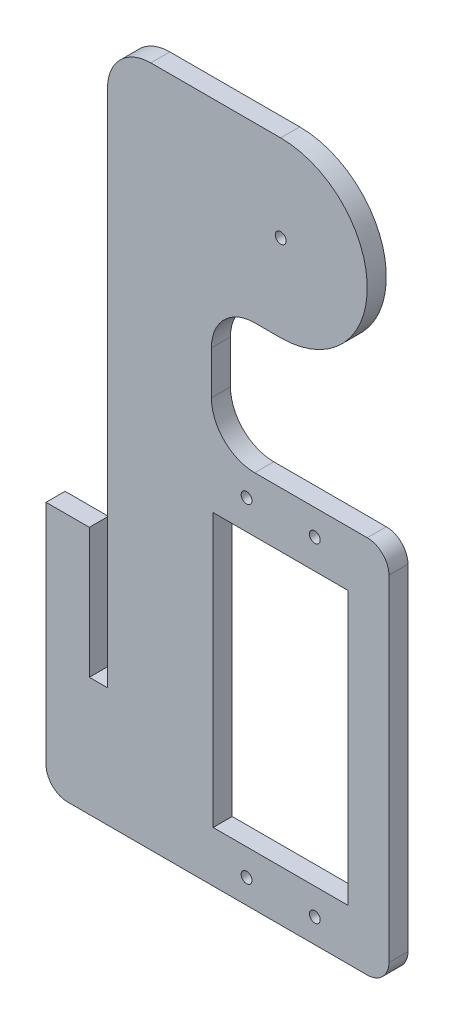
from build123d import *

# Parameters (mm, degrees)
SKETCH1_R           = 0.79375
SKETCH1_W           = 19.812
SKETCH1_H           = 40
BOSS_EXTRUDE1_DEPTH = 2.794
FILLET1_R           = 6.35
FILLET2_R           = 6.35
FILLET3_R           = 3.175


with BuildPart() as part:
    # Sketch1 → Boss-Extrude1 (new body)
    with BuildSketch(Plane.XY):
        with BuildLine():
            Line((6.440932537, 4.734159763), (50.8, 4.734159763))
            Line((50.8, 4.734159763), (50.8, 36.343152622))
            Line((50.8, 36.343152622), (50.8, 60.284785263))
            Line((50.8, 60.284785263), (24.765, 60.284785263))
            Line((24.765, 60.284785263), (24.765, 79.327185263))
            Line((24.765, 79.327185263), (34.925, 79.327185263))
            ThreePointArc((34.925, 79.327185263), (47.625, 92.027185263), (34.925, 104.727185263))
            Line((34.925, 104.727185263), (9.525, 104.727185263))
            Line((9.525, 104.727185263), (9.525, 38.1))
            Line((9.525, 38.1), (9.525, 22.177185263))
            Line((9.525, 22.177185263), (6.858, 22.177185263))
            Line((6.858, 22.177185263), (6.858, 41.227185263))
            Line((6.858, 41.227185263), (0.508, 41.227185263))
            Line((0.508, 41.227185263), (0.508, 9.525))
            Line((0.508, 9.525), (0.508, 4.734159763))
            Line((0.508, 4.734159763), (6.440932537, 4.734159763))
        make_face()
        with Locations((34.925, 92.027185263)):
            Circle(SKETCH1_R, mode=Mode.SUBTRACT)
        with Locations((29.9212, 8.283385263)):
            Circle(SKETCH1_R, mode=Mode.SUBTRACT)
        with Locations((39.9288, 8.283385263)):
            Circle(SKETCH1_R, mode=Mode.SUBTRACT)
        with Locations((29.9212, 56.517985263)):
            Circle(SKETCH1_R, mode=Mode.SUBTRACT)
        with Locations((39.9288, 56.517985263)):
            Circle(SKETCH1_R, mode=Mode.SUBTRACT)
        with Locations((34.925, 32.177185263)):
            Rectangle(SKETCH1_W, SKETCH1_H, mode=Mode.SUBTRACT)
    extrude(amount=BOSS_EXTRUDE1_DEPTH)

    # Fillet1
    fillet1_edges = [part.edges().sort_by_distance(p)[0] for p in [
        (24.765, 60.284785263, 1.397),
        (24.765, 79.327185263, 1.397),
    ]]
    fillet(fillet1_edges, radius=FILLET1_R)

    # Fillet2
    fillet2_edges = [part.edges().sort_by_distance(p)[0] for p in [
        (9.525, 104.727185263, 1.397),
    ]]
    fillet(fillet2_edges, radius=FILLET2_R)

    # Fillet3
    fillet3_edges = [part.edges().sort_by_distance(p)[0] for p in [
        (0.508, 4.734159763, 1.397),
        (50.8, 4.734159763, 1.397),
        (50.8, 60.284785263, 1.397),
    ]]
    fillet(fillet3_edges, radius=FILLET3_R)


solid = part.part
